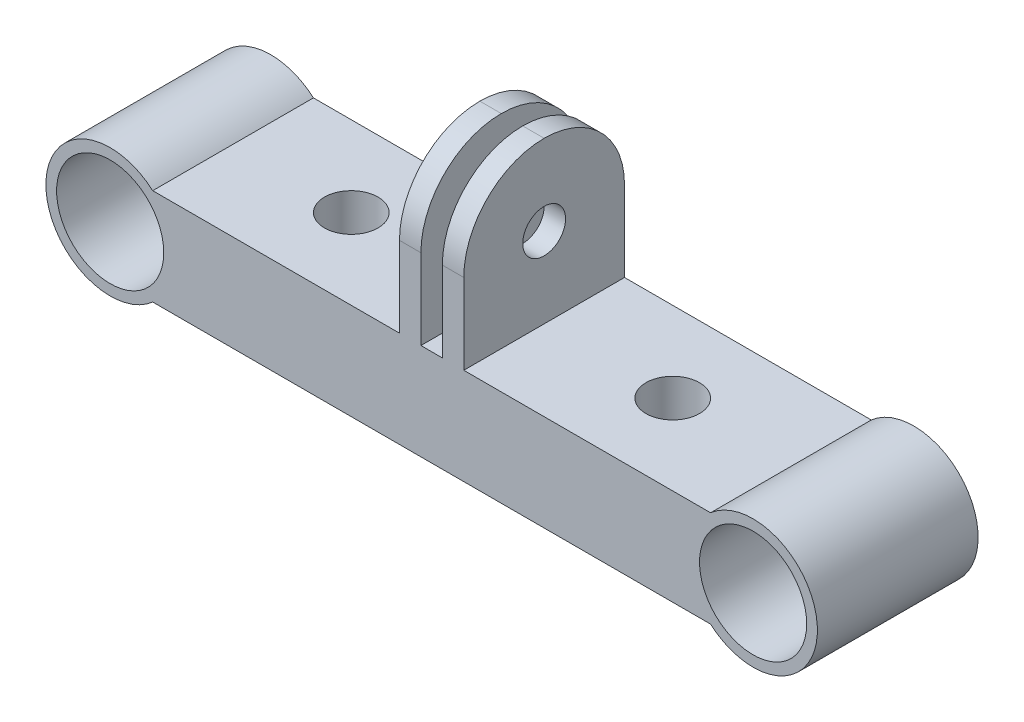
from build123d import *

# Parameters (mm, degrees)
SKETCH_1_R          = 5
EXTRUDE_1_DEPTH     = 7.5
SKETCH_2_W          = 6
SKETCH_2_H          = 15
EXTRUDE_2_DEPTH     = 15
FILLET_1_R          = 7.5
SKETCH_3_W          = 2
SKETCH_3_H          = 15
CUT_EXTRUDE_1_DEPTH = 44.603325561
SKETCH_4_R          = 2
CUT_EXTRUDE_2_DEPTH = 15
SKETCH_7_R          = 2.5
CUT_EXTRUDE_3_DEPTH = 40.714606885


with BuildPart() as part:
    # 草图1 → 凸台-拉伸1 (new, symmetric)
    with BuildSketch(Plane.XY):
        with BuildLine():
            Line((-26.031373033, 4.5), (26.031373033, 4.5))
            ThreePointArc((26.031373033, 4.5), (36, 0), (26.031373033, -4.5))
            Line((26.031373033, -4.5), (-26.031373033, -4.5))
            ThreePointArc((-26.031373033, -4.5), (-36, 0), (-26.031373033, 4.5))
        make_face()
        with Locations((-30, 0)):
            Circle(SKETCH_1_R, mode=Mode.SUBTRACT)
        with Locations((30, 0)):
            Circle(SKETCH_1_R, mode=Mode.SUBTRACT)
    extrude(amount=EXTRUDE_1_DEPTH, both=True)

    # 草图2 → 凸台-拉伸2 (add)
    with BuildSketch(Plane.XY.offset(7.5)):
        with Locations((0, 12)):
            Rectangle(SKETCH_2_W, SKETCH_2_H)
    extrude(amount=-EXTRUDE_2_DEPTH)

    # 圆角1
    fillet_1_edges = [part.edges().sort_by_distance(p)[0] for p in [
        (0, 19.5, 7.5),
        (0, 19.5, -7.5),
    ]]
    fillet(fillet_1_edges, radius=FILLET_1_R - 0.0001)  # a hair under: the kernel refuses the full size

    # 草图3 → 切除-拉伸1 (cut, through all)
    with BuildSketch(Plane.XY.offset(7.5)):
        with Locations((0, 12)):
            Rectangle(SKETCH_3_W, SKETCH_3_H)
    extrude(amount=-CUT_EXTRUDE_1_DEPTH, mode=Mode.SUBTRACT)

    # 草图4 → 切除-拉伸2 (cut)
    with BuildSketch(Plane.ZY.offset(3)):
        with Locations(Location((0, 12, 0), (0, 0, 270))):
            Circle(SKETCH_4_R)
    extrude(amount=-CUT_EXTRUDE_2_DEPTH, mode=Mode.SUBTRACT)

    # 草图7 → 切除-拉伸3 (cut, through all)
    with BuildSketch(Plane(origin=(0, 4.5, 0), x_dir=(1, 0, 0), z_dir=(0, 1, 0))):
        with Locations(Location((-15, 0, 0), (0, 0, 270))):
            Circle(SKETCH_7_R)
        with Locations(Location((15, 0, 0), (0, 0, 270))):
            Circle(SKETCH_7_R)
    extrude(amount=-CUT_EXTRUDE_3_DEPTH, mode=Mode.SUBTRACT)


solid = part.part
